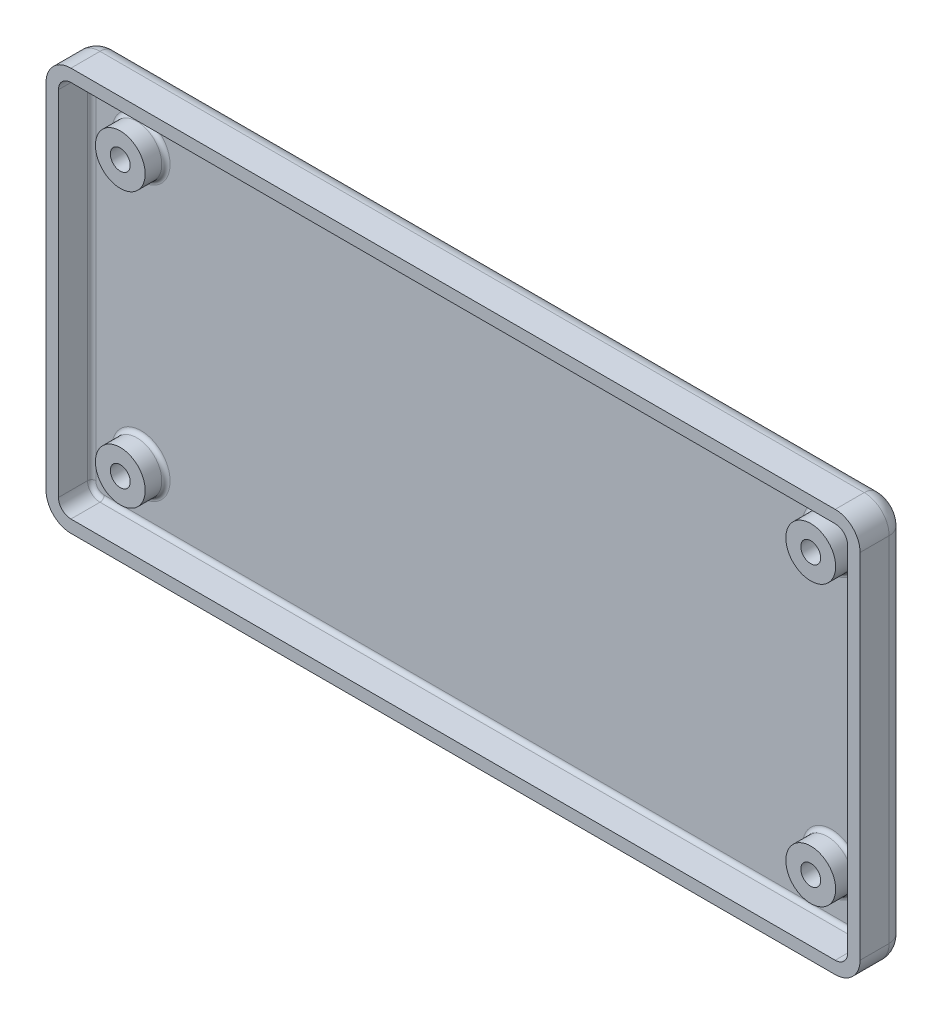
from build123d import *

# Parameters (mm, degrees)
SKETCH1_R                                        = 3
STANDOFFS_DEPTH                                  = 4
STANDOFFS_2_DEPTH                                = 4
STANDOFFS_3_DEPTH                                = 4
STANDOFFS_4_DEPTH                                = 4
SKETCH2_W                                        = 98.075
SKETCH2_H                                        = 48.545
BASE_DEPTH                                       = 1.5
SKETCH5_W                                        = 98.075
SKETCH5_H                                        = 48.545
SKETCH5_W_2                                      = 95.075
SKETCH5_H_2                                      = 45.545
WALL_DEPTH                                       = 4
FILLET1_R                                        = 3
FILLET2_R                                        = 1.5
FILLET3_R                                        = 2
FILLET4_R                                        = 0.5
CBORE_FOR_M2_PAN_HEAD_MACHINE_SCREW2_D           = 2.4
CBORE_FOR_M2_PAN_HEAD_MACHINE_SCREW2_CBORE_D     = 5
CBORE_FOR_M2_PAN_HEAD_MACHINE_SCREW2_CBORE_DEPTH = 1.6


with BuildPart() as part:
    # Sketch1 → Standoffs (new body)
    with BuildSketch(Plane(origin=(0, 0, 0), x_dir=(-1, 0, 0), z_dir=(0, 0, -1))):
        with Locations((-153.035, -93.345)):
            Circle(SKETCH1_R)
    extrude(amount=STANDOFFS_DEPTH)



with BuildPart() as body_2:
    # Sketch1 → Standoffs 2 (new body)
    with BuildSketch(Plane(origin=(0, 0, 0), x_dir=(-1, 0, 0), z_dir=(0, 0, -1))):
        with Locations((-153.035, -127)):
            Circle(SKETCH1_R)
    extrude(amount=STANDOFFS_2_DEPTH)


with BuildPart() as body_3:
    # Sketch1 → Standoffs 3 (new body)
    with BuildSketch(Plane(origin=(0, 0, 0), x_dir=(-1, 0, 0), z_dir=(0, 0, -1))):
        with Locations((-69.85, -127)):
            Circle(SKETCH1_R)
    extrude(amount=STANDOFFS_3_DEPTH)


with BuildPart() as body_4:
    # Sketch1 → Standoffs 4 (new body)
    with BuildSketch(Plane(origin=(0, 0, 0), x_dir=(-1, 0, 0), z_dir=(0, 0, -1))):
        with Locations((-69.85, -93.98)):
            Circle(SKETCH1_R)
    extrude(amount=STANDOFFS_4_DEPTH)


with BuildPart() as part_1:
    add(part.part)

    add(body_2.part)  # Base merges body 2

    add(body_3.part)  # Base merges body 3

    add(body_4.part)  # Base merges body 4
    # Sketch2 → Base (add)
    with BuildSketch(Plane(origin=(0, 0, -4), x_dir=(-1, 0, 0), z_dir=(0, 0, -1))):
        with Locations((-111.4425, -110.1725)):
            Rectangle(SKETCH2_W, SKETCH2_H)
    extrude(amount=-BASE_DEPTH)

    # Sketch5 → Wall (add)
    with BuildSketch(Plane.XY.offset(-2.5)):
        with Locations((111.4425, -110.1725)):
            Rectangle(SKETCH5_W, SKETCH5_H)
        with Locations((111.4425, -110.1725)):
            Rectangle(SKETCH5_W_2, SKETCH5_H_2, mode=Mode.SUBTRACT)
    extrude(amount=WALL_DEPTH)

    # Fillet1
    fillet1_edges = [part_1.edges().sort_by_distance(p)[0] for p in [
        (62.405, -85.9, -1.25),
        (160.48, -85.9, -1.25),
        (160.48, -134.445, -1.25),
        (62.405, -134.445, -1.25),
    ]]
    fillet(fillet1_edges, radius=FILLET1_R)

    # Fillet2
    fillet2_edges = [part_1.edges().sort_by_distance(p)[0] for p in [
        (158.98, -87.4, -0.5),
        (158.98, -132.945, -0.5),
        (63.905, -132.945, -0.5),
        (63.905, -87.4, -0.5),
    ]]
    fillet(fillet2_edges, radius=FILLET2_R)

    # Fillet3
    fillet3_edges = [part_1.edges().sort_by_distance(p)[0] for p in [
        (159.601320344, -133.566320344, -4),
        (160.48, -110.1725, -4),
        (159.601320344, -86.778679656, -4),
        (111.4425, -85.9, -4),
        (63.283679656, -86.778679656, -4),
        (62.405, -110.1725, -4),
        (63.283679656, -133.566320344, -4),
        (111.4425, -134.445, -4),
    ]]
    fillet(fillet3_edges, radius=FILLET3_R)

    # Fillet4
    fillet4_edges = [part_1.edges().sort_by_distance(p)[0] for p in [
        (158.540660172, -87.839339828, -2.5),
        (158.98, -110.1725, -2.5),
        (158.540660172, -132.505660172, -2.5),
        (111.4425, -132.945, -2.5),
        (64.344339828, -132.505660172, -2.5),
        (63.905, -110.1725, -2.5),
        (64.344339828, -87.839339828, -2.5),
        (111.4425, -87.4, -2.5),
        (72.85, -93.98, -2.5),
        (156.035, -127, -2.5),
        (156.035, -93.345, -2.5),
        (72.85, -127, -2.5),
    ]]
    fillet(fillet4_edges, radius=FILLET4_R)

    # CBORE for M2 Pan Head Machine Screw2 (through all)
    with Locations(Plane(origin=(0, 0, -4), x_dir=(-1, 0, 0), z_dir=(0, 0, -1))):
        with Locations((-69.85, -93.98), (-153.035, -93.345), (-153.035, -127), (-69.85, -127)):
            CounterBoreHole(CBORE_FOR_M2_PAN_HEAD_MACHINE_SCREW2_D / 2, CBORE_FOR_M2_PAN_HEAD_MACHINE_SCREW2_CBORE_D / 2, CBORE_FOR_M2_PAN_HEAD_MACHINE_SCREW2_CBORE_DEPTH)


solid = part_1.part
